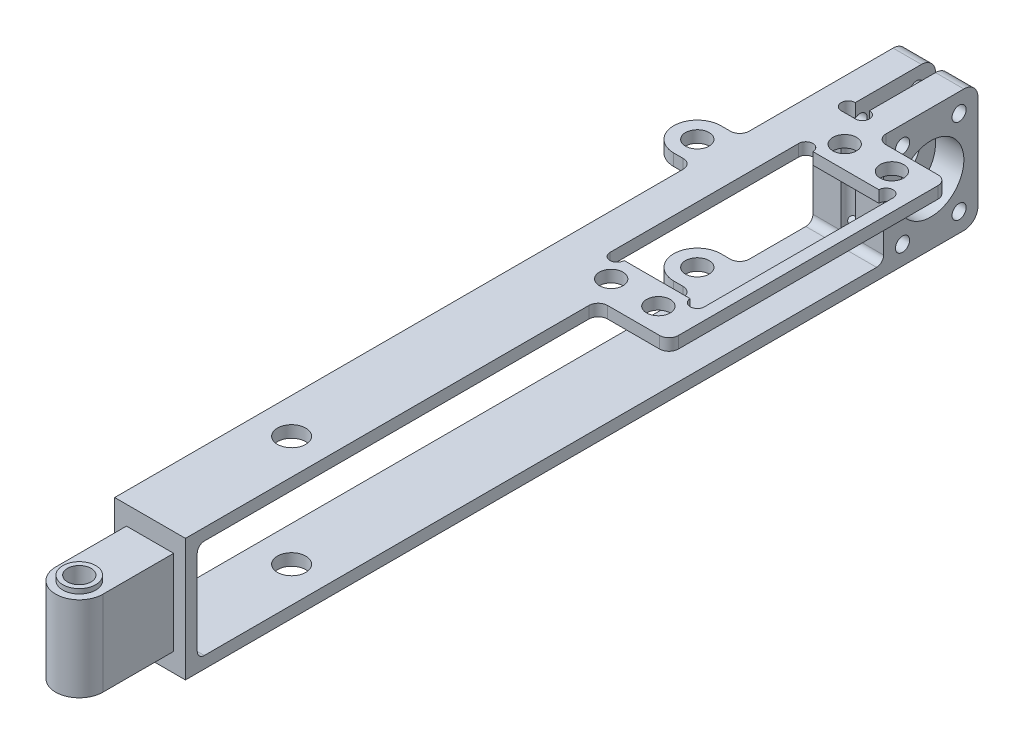
from build123d import *
from build123d.topology import SkipClean

# Parameters (mm, degrees)
SKETCH_1_W           = 15
SKETCH_1_H           = 26
EXTRUDE_1_DEPTH      = 168
SKETCH_2_R           = 2.5
EXTRUDE_2_DEPTH      = 9
EXTRUDE_3_DEPTH      = 1
EXTRUDE_3_DEPTH_BACK = 19
SKETCH_3_R           = 3.5
SKETCH_3_R_2         = 2.5
SKETCH_4_W           = 85
SKETCH_4_H           = 21
CUT_EXTRUDE_1_DEPTH  = 24
CUT_EXTRUDE_2_DEPTH  = 33
SKETCH_6_W           = 78
SKETCH_6_H           = 21
CUT_EXTRUDE_3_DEPTH  = 33
SKETCH_7_W           = 15
SKETCH_7_H           = 59
EXTRUDE_4_DEPTH      = 26
SKETCH_8_R           = 2.5
CUT_EXTRUDE_4_DEPTH  = 23.5
SKETCH_9_R           = 2.5
EXTRUDE_5_DEPTH      = 2.5
EXTRUDE_START        = -2.5
SKETCH_10_R          = 2.5
EXTRUDE_6_DEPTH      = 2.5
SKETCH_11_R          = 3
CUT_EXTRUDE_5_DEPTH  = 82.5
SKETCH_12_W          = 56.5
SKETCH_12_H          = 21
CUT_EXTRUDE_6_DEPTH  = 82.5
SKETCH_13_W          = 15
SKETCH_13_H          = 59
CUT_EXTRUDE_7_DEPTH  = 23.5
SKETCH_14_W          = 15
SKETCH_14_H          = 21
CUT_EXTRUDE_8_DEPTH  = 23.5
EXTRUDE_START_2      = -23.5
EXTRUDE_7_DEPTH      = 23.5
FILLET_1_R           = 2
SKETCH_16_R          = 1.5
SKETCH_16_R_2        = 7
CUT_EXTRUDE_9_DEPTH  = 23.5
FILLET_2_R           = 1.5
FILLET_3_R           = 3


with BuildPart() as part:
    # 草图1 → 凸台-拉伸1 (new body)
    with BuildSketch(Plane.XY):
        with Locations((7.5, 13)):
            Rectangle(SKETCH_1_W, SKETCH_1_H)
    extrude(amount=EXTRUDE_1_DEPTH)

    # 草图2 → 凸台-拉伸2 (add, symmetric)
    with BuildSketch(Plane(origin=(0, 13, 0), x_dir=(1, 0, 0), z_dir=(0, 1, 0))):
        with BuildLine():
            Line((12.5, -183), (12.5, -168))
            Line((12.5, -168), (2.5, -168))
            Line((2.5, -168), (2.5, -183))
            ThreePointArc((2.5, -183), (7.5, -188), (12.5, -183))
        make_face()
        with Locations(Location((7.5, -183, 0), (0, 0, 180))):
            Circle(SKETCH_2_R, mode=Mode.SUBTRACT)
    extrude(amount=EXTRUDE_2_DEPTH, both=True)

    # 草图3 → 凸台-拉伸3 (add, two sides: drawn at the far end of the back side and taken through both)
    with BuildSketch(Plane(origin=(0, 22, 0), x_dir=(1, 0, 0), z_dir=(0, 1, 0)).offset(-EXTRUDE_3_DEPTH_BACK)):
        with Locations(Location((7.5, -183, 0), (0, 0, 180))):
            Circle(SKETCH_3_R)
        with Locations(Location((7.5, -183, 0), (0, 0, 180))):
            Circle(SKETCH_3_R_2, mode=Mode.SUBTRACT)
    extrude(amount=EXTRUDE_3_DEPTH + EXTRUDE_3_DEPTH_BACK)

    # 草图4 → 切除-拉伸1 (cut)
    with BuildSketch(Plane(origin=(15, 0, 0), x_dir=(0, 0, -1), z_dir=(1, 0, 0))):
        with Locations((-123, 13)):
            Rectangle(SKETCH_4_W, SKETCH_4_H)
    extrude(amount=-CUT_EXTRUDE_1_DEPTH, mode=Mode.SUBTRACT)

    # 草图5 → 切除-拉伸2 (cut)
    with BuildSketch(Plane(origin=(0, 26, 0), x_dir=(1, 0, 0), z_dir=(0, 1, 0))):
        with BuildLine():
            Line((6, 0), (9, 0))
            Line((9, 0), (9, -17))
            ThreePointArc((9, -17), (10.5, -18.5), (9, -20))
            Line((9, -20), (6, -20))
            ThreePointArc((6, -20), (4.5, -18.5), (6, -17))
            Line((6, -17), (6, 0))
        make_face()
    extrude(amount=-CUT_EXTRUDE_2_DEPTH, mode=Mode.SUBTRACT)

    # 草图6 → 切除-拉伸3 (cut)
    with BuildSketch(Plane(origin=(15, 0, 0), x_dir=(0, 0, -1), z_dir=(1, 0, 0))):
        with Locations((-39, 13)):
            Rectangle(SKETCH_6_W, SKETCH_6_H)
    extrude(amount=-CUT_EXTRUDE_3_DEPTH, mode=Mode.SUBTRACT)

    # 草图7 → 凸台-拉伸4 (add)
    with BuildSketch(Plane(origin=(0, 26, 0), x_dir=(1, 0, 0), z_dir=(0, 1, 0))):
        with Locations((22.5, -51)):
            Rectangle(SKETCH_7_W, SKETCH_7_H)
    extrude(amount=-EXTRUDE_4_DEPTH)

    # 草图8 → 切除-拉伸4 (cut)
    with BuildSketch(Plane(origin=(0, 26, 0), x_dir=(1, 0, 0), z_dir=(0, 1, 0))):
        with Locations(Location((12.5, -25.75, 0), (0, 0, 180))):
            Circle(SKETCH_8_R)
        with Locations(Location((22.5, -25.75, 0), (0, 0, 180))):
            Circle(SKETCH_8_R)
        with Locations(Location((12.5, -75.25, 0), (0, 0, 180))):
            Circle(SKETCH_8_R)
        with Locations(Location((22.5, -75.25, 0), (0, 0, 180))):
            Circle(SKETCH_8_R)
        with BuildLine():
            Line((10.5, -30.5), (24.5, -30.5))
            ThreePointArc((24.5, -30.5), (26, -29), (27.5, -30.5))
            Line((27.5, -30.5), (27.5, -70.5))
            ThreePointArc((27.5, -70.5), (26, -72), (24.5, -70.5))
            Line((24.5, -70.5), (10.5, -70.5))
            ThreePointArc((10.5, -70.5), (9, -72), (7.5, -70.5))
            Line((7.5, -70.5), (7.5, -30.5))
            ThreePointArc((7.5, -30.5), (9, -29), (10.5, -30.5))
        make_face()
    extrude(amount=-CUT_EXTRUDE_4_DEPTH, mode=Mode.SUBTRACT)

    # 草图9 → 凸台-拉伸5 (add)
    with SkipClean():  # the faces are left unmerged after this step: merging them gives an invalid solid
        with BuildSketch(Plane(origin=(0, 26, 0), x_dir=(1, 0, 0), z_dir=(0, 1, 0))):
            with BuildLine():
                Line((-4, -35.5), (1, -35.5))
                Line((1, -35.5), (1, -45.5))
                Line((1, -45.5), (-4, -45.5))
                ThreePointArc((-4, -45.5), (-9, -40.5), (-4, -35.5))
            make_face()
            with Locations(Location((-4, -40.5, 0), (0, 0, 180))):
                Circle(SKETCH_9_R, mode=Mode.SUBTRACT)
        extrude(amount=-EXTRUDE_5_DEPTH)

    # 草图10 → 凸台-拉伸6 (add)
    with SkipClean():  # the faces are left unmerged after this step: merging them gives an invalid solid
        with BuildSketch(Plane.XZ.offset(EXTRUDE_START)):
            with BuildLine():
                Line((-4, 45.5), (1, 45.5))
                Line((1, 45.5), (1, 35.5))
                Line((1, 35.5), (-4, 35.5))
                ThreePointArc((-4, 35.5), (-9, 40.5), (-4, 45.5))
            make_face()
            with Locations(Location((-4, 40.5, 0), (0, 0, 180))):
                Circle(SKETCH_10_R, mode=Mode.SUBTRACT)
        extrude(amount=EXTRUDE_6_DEPTH)

    # 草图11 → 切除-拉伸5 (cut)
    with SkipClean():  # the faces are left unmerged after this step: merging them gives an invalid solid
        with BuildSketch(Plane.XZ):
            with Locations(Location((7.5, 138, 0), (0, 0, 270))):
                Circle(SKETCH_11_R)
        extrude(amount=-CUT_EXTRUDE_5_DEPTH, mode=Mode.SUBTRACT)

    # 草图12 → 切除-拉伸6 (cut)
    with BuildSketch(Plane.ZY.offset(-15)):
        with Locations((49.75, 13)):
            Rectangle(SKETCH_12_W, SKETCH_12_H)
    extrude(amount=-CUT_EXTRUDE_6_DEPTH, mode=Mode.SUBTRACT)

    # 草图13 → 切除-拉伸7 (cut)
    with BuildSketch(Plane.XZ):
        with Locations((22.5, 51)):
            Rectangle(SKETCH_13_W, SKETCH_13_H)
    extrude(amount=-CUT_EXTRUDE_7_DEPTH, mode=Mode.SUBTRACT)

    # 草图14 → 切除-拉伸8 (cut)
    with BuildSketch(Plane(origin=(0, 0, 78), x_dir=(-1, 0, 0), z_dir=(0, 0, -1))):
        with Locations((-7.5, 13)):
            Rectangle(SKETCH_14_W, SKETCH_14_H)
    extrude(amount=-CUT_EXTRUDE_8_DEPTH, mode=Mode.SUBTRACT)

    # 草图15 → 凸台-拉伸7 (add)
    with BuildSketch(Plane.XZ.offset(EXTRUDE_START_2)):
        with BuildLine():
            Line((0, 20), (6, 20))
            ThreePointArc((6, 20), (4.5, 18.5), (6, 17))
            Line((6, 17), (6, 0))
            Line((6, 0), (0, 0))
            Line((0, 0), (0, 20))
        make_face()
        with BuildLine():
            Line((9, 20), (15, 20))
            Line((15, 20), (15, 0))
            Line((15, 0), (9, 0))
            Line((9, 0), (9, 17))
            ThreePointArc((9, 17), (10.5, 18.5), (9, 20))
        make_face()
    extrude(amount=EXTRUDE_7_DEPTH)

    # 圆角1
    # the kernel refuses this fillet: 2 mm, written as the material it adds along each edge
    with BuildSketch(Plane(origin=(15, 26, 80.5), x_dir=(1, 0, 0), z_dir=(0, -1, 0)), Plane(origin=(0, 26, 35.5), x_dir=(-1, 0, 0), z_dir=(0, -1, 0)), Plane(origin=(0, 23.5, 45.5), x_dir=(-1, 0, 0), z_dir=(0, 1, 0)), Plane(origin=(0, 2.5, 45.5), x_dir=(0, 0, 1), z_dir=(0, -1, 0))) as fillet_1_piece_1:
        with BuildLine():
            CenterArc((FILLET_1_R, FILLET_1_R), FILLET_1_R, 180, 90)
            Line((0, FILLET_1_R), (0, 0))
            Line((0, 0), (FILLET_1_R, 0))
        make_face()
    extrude(amount=2.5)
    with BuildSketch(Plane(origin=(15, 26, 21.5), x_dir=(1, 0, 0), z_dir=(0, -1, 0)), Plane(origin=(0, 0, 35.5), x_dir=(-1, 0, 0), z_dir=(0, 1, 0))) as fillet_1_piece_2:
        with BuildLine():
            CenterArc((FILLET_1_R, -FILLET_1_R), FILLET_1_R, 90, 90)
            Line((0, -FILLET_1_R), (0, 0))
            Line((0, 0), (FILLET_1_R, 0))
        make_face()
    extrude(amount=2.5)
    # the kernel refuses this fillet: 2 mm, written as the material it takes off along each edge
    with BuildSketch(Plane(origin=(30, 31, 21.5), x_dir=(-1, 0, 0), z_dir=(0, -1, 0)), Plane(origin=(30, 31, 80.5), x_dir=(0, 0, -1), z_dir=(0, -1, 0))) as fillet_1_2_piece_1:
        with BuildLine():
            CenterArc((FILLET_1_R, -FILLET_1_R), FILLET_1_R, 90, 90)
            Line((0, -FILLET_1_R), (0, 0))
            Line((0, 0), (FILLET_1_R, 0))
        make_face()
    extrude(amount=12.5, mode=Mode.SUBTRACT)

    # 草图16 → 切除-拉伸9 (cut)
    with BuildSketch(Plane.ZY):
        with Locations((4, 4)):
            Circle(SKETCH_16_R)
        with Locations((16, 4)):
            Circle(SKETCH_16_R)
        with Locations((4, 22)):
            Circle(SKETCH_16_R)
        with Locations((16, 22)):
            Circle(SKETCH_16_R)
        with Locations((10, 13)):
            Circle(SKETCH_16_R_2)
    extrude(amount=-CUT_EXTRUDE_9_DEPTH, mode=Mode.SUBTRACT)

    # 圆角2
    # the kernel refuses this fillet: 1.5 mm, written as the material it adds along each edge
    with BuildSketch(Plane(origin=(0, 23.5, 20), x_dir=(0, 0, 1), z_dir=(1, 0, 0)), Plane(origin=(5.25, 23.5, 20), x_dir=(0, 0, 1), z_dir=(1, 0, 0))) as fillet_2_piece_1:
        with BuildLine():
            CenterArc((FILLET_2_R, FILLET_2_R), FILLET_2_R, 180, 90)
            Line((0, FILLET_2_R), (0, 0))
            Line((0, 0), (FILLET_2_R, 0))
        make_face()
    extrude(amount=9.75)
    with BuildSketch(Plane(origin=(0, 2.5, 20), x_dir=(0, 0, 1), z_dir=(1, 0, 0)), Plane(origin=(5.25, 2.5, 20), x_dir=(0, 0, 1), z_dir=(1, 0, 0))) as fillet_2_piece_2:
        with BuildLine():
            CenterArc((FILLET_2_R, -FILLET_2_R), FILLET_2_R, 90, 90)
            Line((0, -FILLET_2_R), (0, 0))
            Line((0, 0), (FILLET_2_R, 0))
        make_face()
    extrude(amount=9.75)
    with BuildSketch(Plane(origin=(15, 2.5, 165.5), x_dir=(0, 1, 0), z_dir=(-1, 0, 0)), Plane(origin=(15, 23.5, 165.5), x_dir=(0, 0, -1), z_dir=(-1, 0, 0))) as fillet_2_piece_3:
        with BuildLine():
            CenterArc((FILLET_2_R, FILLET_2_R), FILLET_2_R, 180, 90)
            Line((0, FILLET_2_R), (0, 0))
            Line((0, 0), (FILLET_2_R, 0))
        make_face()
    extrude(amount=15)

    # 圆角3
    fillet_3_edges = [part.edges().sort_by_distance(p)[0] for p in [
        (12, 26, 0),
        (3, 0, 0),
        (3, 26, 0),
        (12, 0, 0),
    ]]
    fillet(fillet_3_edges, radius=FILLET_3_R)


solid = part.part
